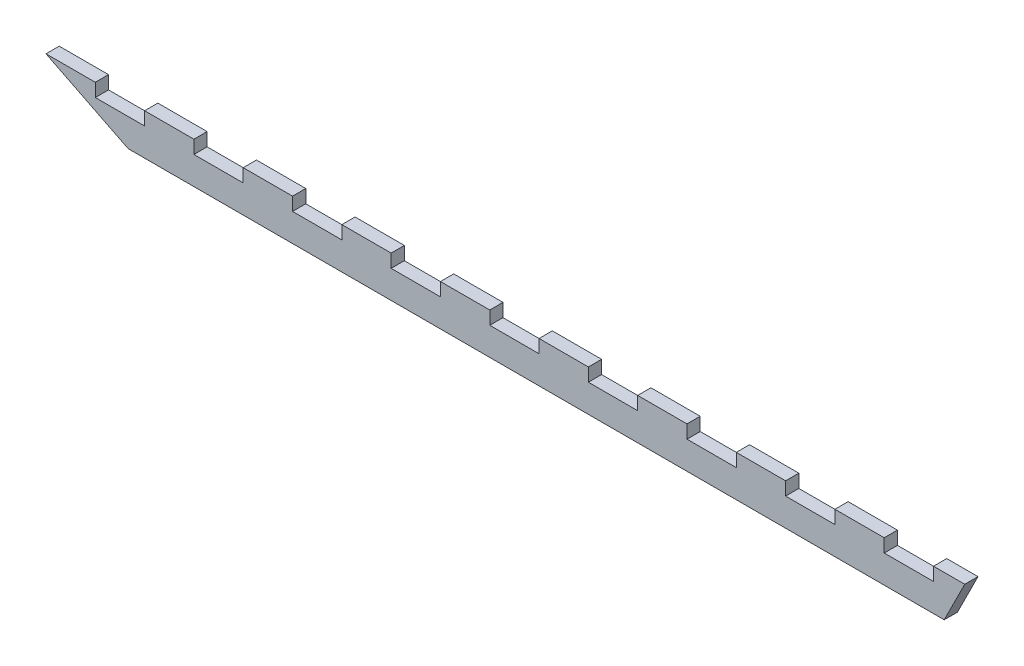
from build123d import *

# Parameters (mm, degrees)
BOSS_EXTRUDE1_DEPTH = 1.61
CUT_EXTRUDE1_REACH  = 117.941
SKETCH2_W           = 12
SKETCH2_H           = 3.22
LPATTERN1_COUNT     = 9
LPATTERN1_PITCH     = 24


with BuildPart() as part:
    # Sketch1 → Boss-Extrude1 (new, symmetric)
    with BuildSketch(Plane.XY):
        Polygon((-95.775442885, -4.703941319), (-115.775442885, 5.296058681), (107.831354865, 5.296058681), (102.831354865, -4.703941319), align=None)
    extrude(amount=BOSS_EXTRUDE1_DEPTH, both=True)

    # Sketch2 → Cut-Extrude1 (cut, up to next)
    with BuildSketch(Plane.XY.offset(1.61), mode=Mode.PRIVATE) as cut_extrude1_sk1:
        with Locations((-97.775442885, 3.686058681)):
            Rectangle(SKETCH2_W, SKETCH2_H)
    cut_extrude1_tool1 = extrude(cut_extrude1_sk1.sketch, amount=-CUT_EXTRUDE1_REACH, mode=Mode.PRIVATE) & part.part
    cut_extrude1 = cut_extrude1_tool1.solids().sort_by_distance((-97.775443, 3.686059, 1.61))[0]
    add(cut_extrude1, mode=Mode.SUBTRACT)

    # LPattern1: Cut-Extrude1 ×9
    with Locations(*[(i * LPATTERN1_PITCH, 0, 0) for i in range(1, LPATTERN1_COUNT)]):
        add(cut_extrude1, mode=Mode.SUBTRACT)


solid = part.part
